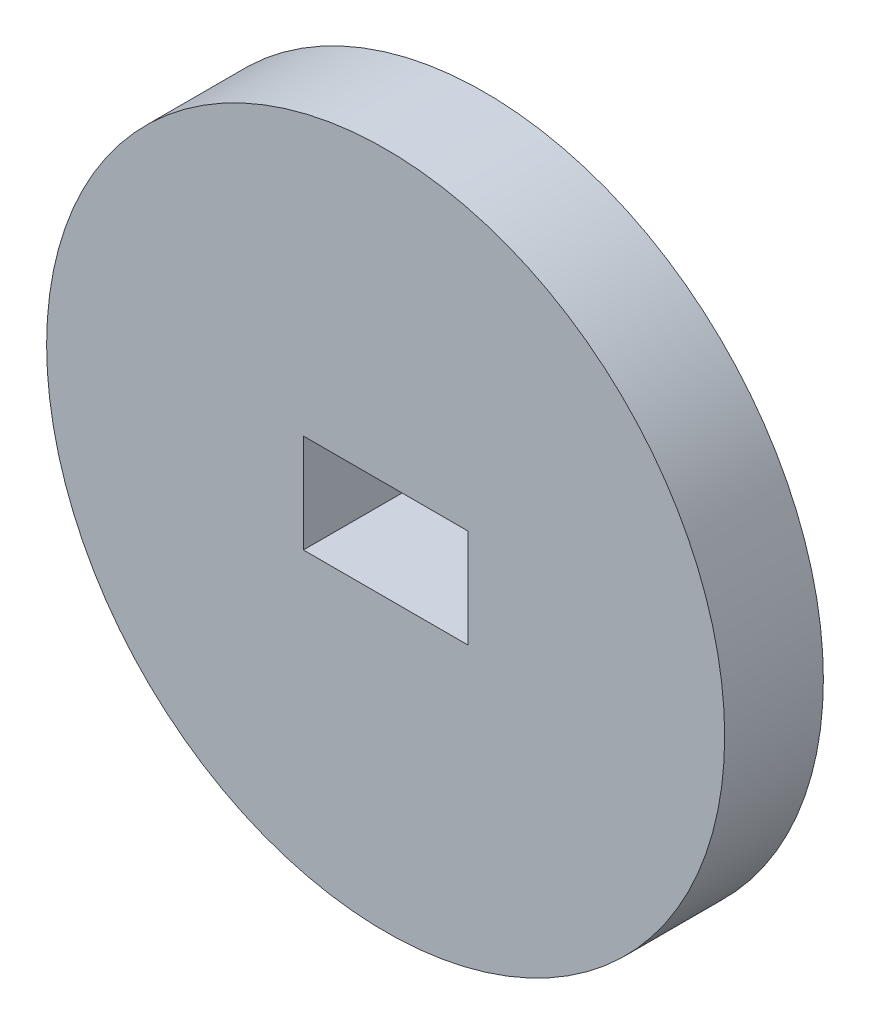
from build123d import *

# Parameters (mm, degrees)
SKETCH2_R           = 10.30551588
SKETCH2_W           = 5
SKETCH2_H           = 3
BOSS_EXTRUDE1_DEPTH = 3


# Read off the part's stored shape, not the designer's step: Gear 60pitch part02.STEP
with BuildPart() as part:
    # Sketch2 → Boss-Extrude1 (new body)
    with BuildSketch(Plane.XY.offset(1)):
        Circle(SKETCH2_R)
        Rectangle(SKETCH2_W, SKETCH2_H, mode=Mode.SUBTRACT)
    extrude(amount=BOSS_EXTRUDE1_DEPTH)


solid = part.part
